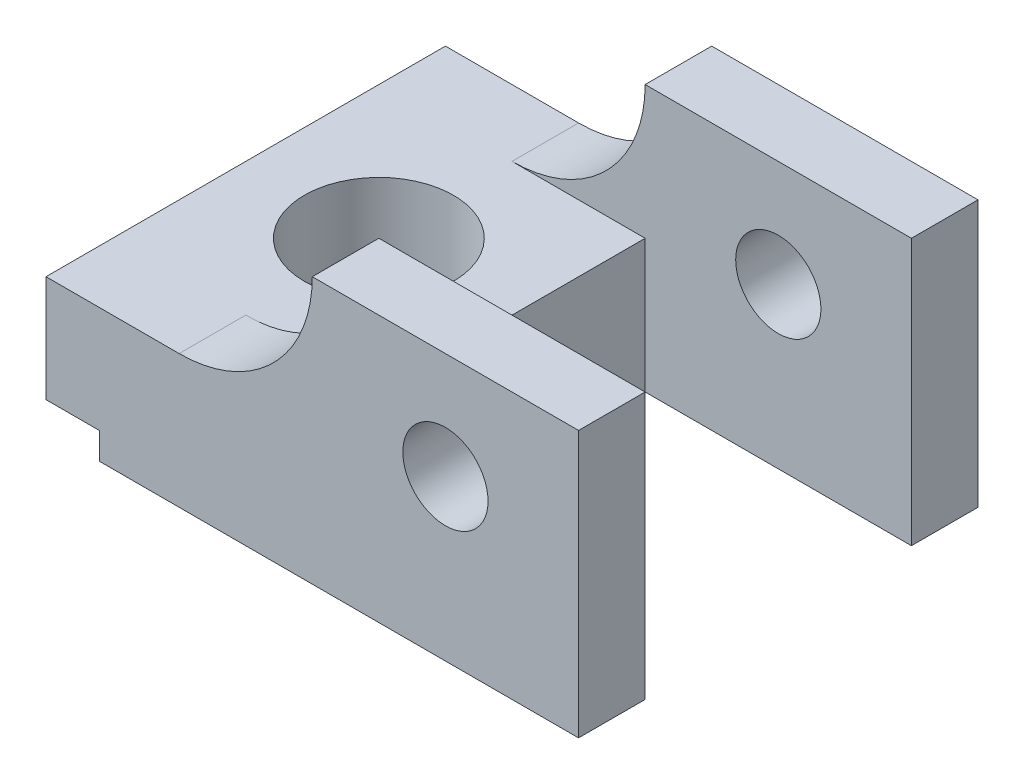
from build123d import *

# Parameters (mm, degrees)
CROQUIS1_R              = 1.6
SALIENTE_EXTRUIR1_DEPTH = 15
CROQUIS2_W              = 10
CROQUIS2_H              = 10
CORTAR_EXTRUIR1_DEPTH   = 20
REDONDEO1_R             = 5
CROQUIS3_R              = 1.974471168
CORTAR_EXTRUIR2_DEPTH   = 11.2
CROQUIS4_R              = 2.8
CORTAR_EXTRUIR3_DEPTH   = 3
CROQUIS6_W              = 8
CROQUIS6_H              = 15
CROQUIS6_R              = 1.974471168
SALIENTE_EXTRUIR2_DEPTH = 1


with BuildPart() as part:
    # Croquis1 → Saliente-Extruir1 (new body)
    with BuildSketch(Plane.XY):
        Polygon((0, 0), (10, 0), (10, -1), (20, -1), (20, 0), (20, 4), (20, 9), (10, 9), (10, 4), (0, 4), align=None)
        with Locations((15, 5)):
            Circle(CROQUIS1_R, mode=Mode.SUBTRACT)
    extrude(amount=SALIENTE_EXTRUIR1_DEPTH)

    # Croquis2 → Cortar-Extruir1 (cut)
    with BuildSketch(Plane(origin=(0, 9, 0), x_dir=(1, 0, 0), z_dir=(0, 1, 0))):
        with Locations((15, -7.5)):
            Rectangle(CROQUIS2_W, CROQUIS2_H)
    extrude(amount=-CORTAR_EXTRUIR1_DEPTH, mode=Mode.SUBTRACT)

    # Redondeo1
    redondeo1_edges = [part.edges().sort_by_distance(p)[0] for p in [
        (10, 4, 1.25),
        (10, 4, 13.75),
    ]]
    fillet(redondeo1_edges, radius=REDONDEO1_R - 0.0001)  # a hair under: the kernel refuses the full size

    # Croquis3 → Cortar-Extruir2 (cut)
    with BuildSketch(Plane(origin=(0, 4, 0), x_dir=(1, 0, 0), z_dir=(0, 1, 0))):
        with Locations(Location((5, -7.5, 0), (0, 0, 270))):
            Circle(CROQUIS3_R)
    extrude(amount=-CORTAR_EXTRUIR2_DEPTH, mode=Mode.SUBTRACT)

    # Croquis4 → Cortar-Extruir3 (cut)
    with BuildSketch(Plane(origin=(0, 4, 0), x_dir=(1, 0, 0), z_dir=(0, 1, 0))):
        with Locations(Location((5, -7.5, 0), (0, 0, 270))):
            Circle(CROQUIS4_R)
    extrude(amount=-CORTAR_EXTRUIR3_DEPTH, mode=Mode.SUBTRACT)

    # Croquis6 → Saliente-Extruir2 (add)
    with BuildSketch(Plane.XZ):
        with Locations((6, 7.5)):
            Rectangle(CROQUIS6_W, CROQUIS6_H)
        with Locations(Location((5, 7.5, 0), (0, 0, 90))):
            Circle(CROQUIS6_R, mode=Mode.SUBTRACT)
    extrude(amount=SALIENTE_EXTRUIR2_DEPTH)


solid = part.part
